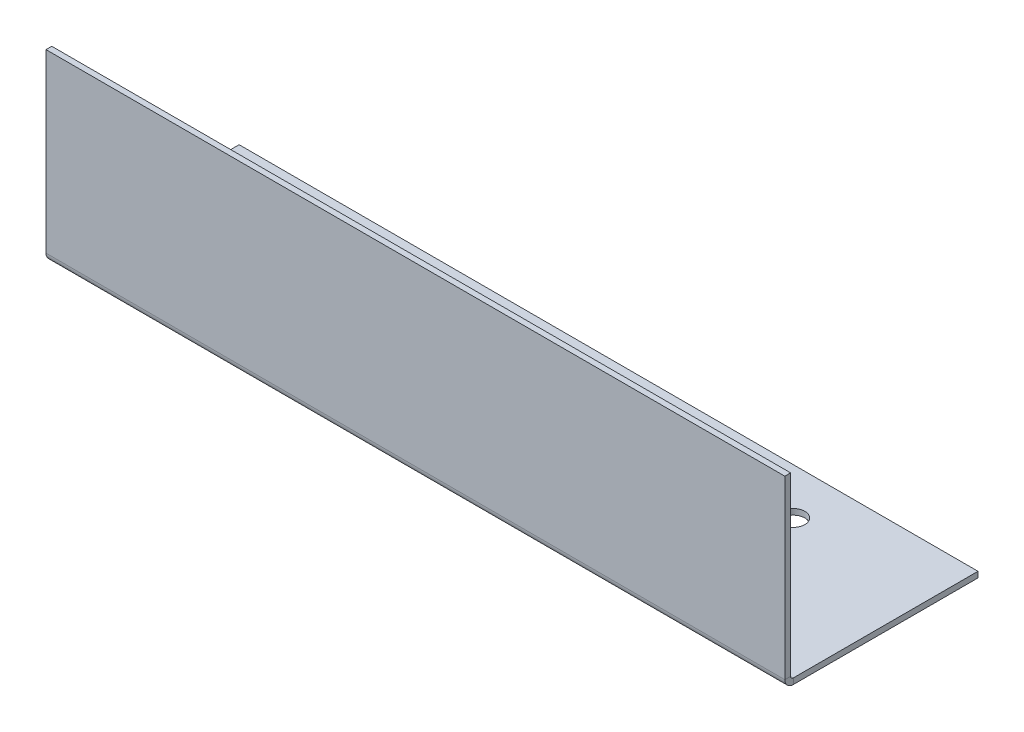
from build123d import *

# Parameters (mm, degrees)
SKETCH1_W          = 203.2
SKETCH1_H          = 50.8
BASE_FLANGE1_DEPTH = 1.5875
EDGE_FLANGE3_DEPTH = 203.2
SKETCH15_R         = 3.175
CUT_EXTRUDE1_DEPTH = 1.5875


# Sheet-metal steps are written as plain solids
with BuildPart() as part:
    # Sketch1 → Base-Flange1 (new body)
    with BuildSketch(Plane(origin=(0, 0, 0), x_dir=(1, 0, 0), z_dir=(0, 1, 0))):
        with Locations((12.472748517, 25.4)):
            Rectangle(SKETCH1_W, SKETCH1_H)
    extrude(amount=-BASE_FLANGE1_DEPTH)

    # Edge-Flange3 section (across the edge) → Edge-Flange3 (add)
    with BuildSketch(Plane(origin=(-89.127251483, 0, 0.7366), x_dir=(0, 0, -1), z_dir=(1, 0, 0))):
        with BuildLine():
            Line((-1.5875, 0.7366), (-1.5875, 49.2125))
            Line((-1.5875, 49.2125), (0, 49.2125))
            Line((0, 49.2125), (0, 0.7366))
            ThreePointArc((0, 0.7366), (0.215745145, 0.215745145), (0.7366, 0))
            Line((0.7366, 0), (0.7366, -1.5875))
            ThreePointArc((0.7366, -1.5875), (-0.90678687, -0.90678687), (-1.5875, 0.7366))
        make_face()
    extrude(amount=EDGE_FLANGE3_DEPTH)

    # Sketch15 → Cut-Extrude1 (cut)
    with BuildSketch(Plane(origin=(0, 0, 0), x_dir=(1, 0, 0), z_dir=(0, 1, 0))):
        with Locations(Location((-51.027251483, 38.1, 0), (0, 0, 270))):
            Circle(SKETCH15_R)
        with Locations(Location((75.972748517, 38.1, 0), (0, 0, 270))):
            Circle(SKETCH15_R)
        with Locations(Location((-51.027251483, 12.7, 0), (0, 0, 270))):
            Circle(SKETCH15_R)
        with Locations(Location((75.972748517, 12.7, 0), (0, 0, 270))):
            Circle(SKETCH15_R)
    extrude(amount=-CUT_EXTRUDE1_DEPTH, mode=Mode.SUBTRACT)


solid = part.part
